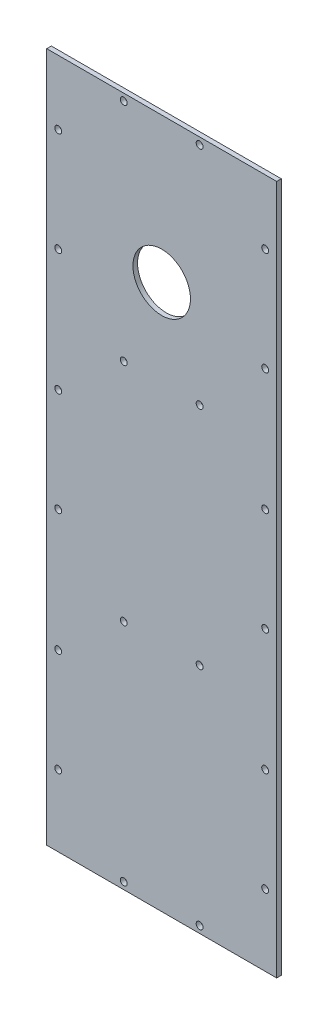
from build123d import *

# Parameters (mm, degrees)
SKETCH1_W           = 100
SKETCH1_H           = 300
BOSS_EXTRUDE1_DEPTH = 2
SKETCH2_R           = 1.5
CUT_EXTRUDE1_DEPTH  = 10
SKETCH3_R           = 12.5
CUT_EXTRUDE2_DEPTH  = 10


with BuildPart() as part:
    # Sketch1 → Boss-Extrude1 (new body)
    with BuildSketch(Plane.XY):
        Rectangle(SKETCH1_W, SKETCH1_H)
    extrude(amount=BOSS_EXTRUDE1_DEPTH)

    # Sketch2 → Cut-Extrude1 (cut)
    with BuildSketch(Plane.XY.offset(2)):
        with Locations((-45, 122)):
            Circle(SKETCH2_R)
        with Locations((-45, 77)):
            Circle(SKETCH2_R)
        with Locations((45, 122)):
            Circle(SKETCH2_R)
        with Locations((45, 77)):
            Circle(SKETCH2_R)
        with Locations((-45, 24)):
            Circle(SKETCH2_R)
        with Locations((-45, -21)):
            Circle(SKETCH2_R)
        with Locations((45, 24)):
            Circle(SKETCH2_R)
        with Locations((45, -21)):
            Circle(SKETCH2_R)
        with Locations((-45, -74)):
            Circle(SKETCH2_R)
        with Locations((-45, -119)):
            Circle(SKETCH2_R)
        with Locations((45, -74)):
            Circle(SKETCH2_R)
        with Locations((45, -119)):
            Circle(SKETCH2_R)
        with Locations((16.5, -147)):
            Circle(SKETCH2_R)
        with Locations((-16.5, -147)):
            Circle(SKETCH2_R)
        with Locations((-16.5, -49)):
            Circle(SKETCH2_R)
        with Locations((16.5, -49)):
            Circle(SKETCH2_R)
        with Locations((-16.5, 49)):
            Circle(SKETCH2_R)
        with Locations((16.5, 49)):
            Circle(SKETCH2_R)
        with Locations((-16.5, 147)):
            Circle(SKETCH2_R)
        with Locations((16.5, 147)):
            Circle(SKETCH2_R)
    extrude(amount=-CUT_EXTRUDE1_DEPTH, mode=Mode.SUBTRACT)

    # Sketch3 → Cut-Extrude2 (cut)
    with BuildSketch(Plane(origin=(0, 0, 0), x_dir=(-1, 0, 0), z_dir=(0, 0, -1))):
        with Locations((0, 87)):
            Circle(SKETCH3_R)
    extrude(amount=-CUT_EXTRUDE2_DEPTH, mode=Mode.SUBTRACT)


solid = part.part
